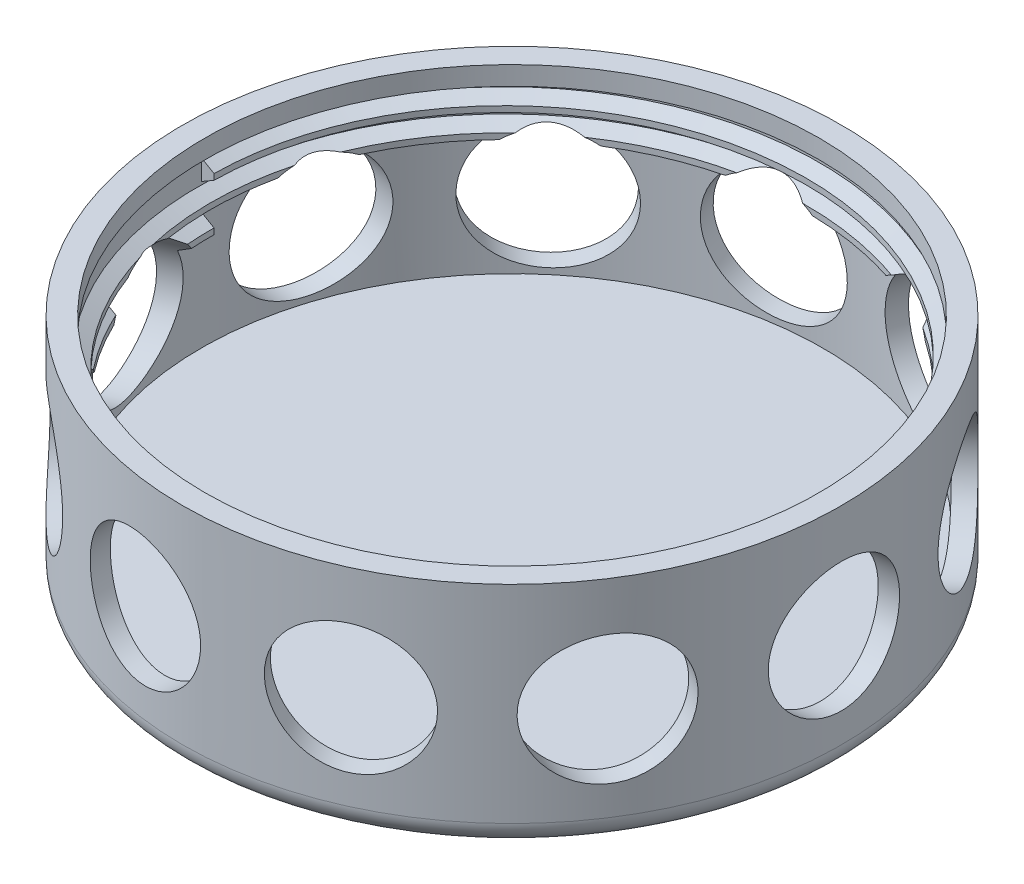
from build123d import *
from build123d.topology import SkipClean

# Parameters (mm, degrees)
SZKIC1_R                    = 14
DODANIE_WYCI_GNI_CIE2_DEPTH = 9
SZKIC5_R                    = 13.2
WYTNIJ_WYCI_GNI_CIE1_DEPTH  = 7
GWINT1_PITCH                = 1
SZKIC22_R                   = 14
SZKIC22_R_2                 = 13.05
DODANIE_WYCI_GNI_CIE3_DEPTH = 0.8
SZKIC23_R                   = 2.75
WYTNIJ_WYCI_GNI_CIE2_DEPTH  = 5
SZYK_KO_OWY1_COUNT          = 11
ZAOKR_GLENIE1_R             = 1


with BuildPart() as part:
    # Szkic1 → Dodanie-wyciągnięcie2 (new body)
    with BuildSketch(Plane(origin=(0, 0, 0), x_dir=(1, 0, 0), z_dir=(0, 1, 0))):
        with Locations(Location((0, 0, 0), (0, 0, 270))):
            Circle(SZKIC1_R)
    extrude(amount=DODANIE_WYCI_GNI_CIE2_DEPTH)

    # Szkic5 → Wytnij-wyciągnięcie1 (cut)
    with BuildSketch(Plane(origin=(0, 9, 0), x_dir=(1, 0, 0), z_dir=(0, 1, 0))):
        with Locations(Location((0, 0, 0), (0, 0, 270))):
            Circle(SZKIC5_R)
    extrude(amount=-WYTNIJ_WYCI_GNI_CIE1_DEPTH, mode=Mode.SUBTRACT)

    # Gwint1: the profile of Profil gwintu2 profile screwed along a right-hand helix of 2 turns, 8 arcs to a turn; built about Z, then put on its axis
    with SkipClean():  # the faces are left unmerged after this step: merging them gives an invalid solid
        gwint1_z = Axis((0, 0, 0), (0, 0, 1))
        gwint1_corners = [(13.2003, 0, -0.000173205), (13.2003, 0, 0.875173202), (12.658734125, 0, 0.562499999), (12.658734125, 0, 0.312499999)]
        with BuildLine(mode=Mode.PRIVATE) as gwint1_profile:
            Line(gwint1_corners[0], gwint1_corners[1])
            Line(gwint1_corners[1], gwint1_corners[2])
            Line(gwint1_corners[2], gwint1_corners[3])
            Line(gwint1_corners[3], gwint1_corners[0])
        gwint1_cap = Face(gwint1_profile.wire())
        gwint1_turn_angles = [0, 22.5, 45, 67.5, 90, 112.5, 135, 157.5, 180, 202.5, 225, 247.5, 270, 292.5, 315, 337.5, 360]
        gwint1_turn_weights = [1, 0.9238795325112867, 1, 0.9238795325112867, 1, 0.9238795325112867, 1, 0.9238795325112867, 1, 0.9238795325112867, 1, 0.9238795325112867, 1, 0.9238795325112867, 1, 0.9238795325112867, 1]
        gwint1_turn_rails = [Edge.make_bspline([Vector(p[0], p[1], 0).rotate(gwint1_z, gwint1_turn_angles[k]) / gwint1_turn_weights[k] + Vector(0, 0, p[2] + GWINT1_PITCH * gwint1_turn_angles[k] / 360) for k in range(17)], [0, 0, 0, 1, 1, 2, 2, 3, 3, 4, 4, 5, 5, 6, 6, 7, 7, 8, 8, 8], 2, gwint1_turn_weights) for p in gwint1_corners]
        gwint1_turn_sides = [Face.make_surface_from_curves(gwint1_turn_rails[p[0]], gwint1_turn_rails[p[1]]) for p in [(0, 1), (1, 2), (2, 3), (3, 0)]]
        gwint1 = Plane(origin=(0, 9, 0), x_dir=(-1, 0, 0), z_dir=(0, -1, 0)) * Solid(Shell([*[p.moved(Location((0, 0, GWINT1_PITCH * i))) for i in range(2) for p in gwint1_turn_sides], gwint1_cap, gwint1_cap.rotate(gwint1_z, 720).moved(Location((0, 0, GWINT1_PITCH * 720 / 360)))]))
        add(gwint1)

    # Szkic22 → Dodanie-wyciągnięcie3 (add)
    with SkipClean():  # the faces are left unmerged after this step: merging them gives an invalid solid
        with BuildSketch(Plane(origin=(0, 9, 0), x_dir=(1, 0, 0), z_dir=(0, 1, 0))):
            with Locations(Location((0, 0, 0), (0, 0, 270))):
                Circle(SZKIC22_R)
            with Locations(Location((0, 0, 0), (0, 0, 270))):
                Circle(SZKIC22_R_2, mode=Mode.SUBTRACT)
        extrude(amount=DODANIE_WYCI_GNI_CIE3_DEPTH)

    # Szkic23 → Wytnij-wyciągnięcie2 (cut)
    with BuildSketch(Plane.XY.offset(16)):
        with Locations((-2, 5)):
            Circle(SZKIC23_R)
    wytnij_wyci_gni_cie2 = extrude(amount=-WYTNIJ_WYCI_GNI_CIE2_DEPTH, mode=Mode.SUBTRACT)

    # Szyk kołowy1: Wytnij-wyciągnięcie2 ×11 about axis
    szyk_ko_owy1_axis = Axis((0, 0, 0), (0, -1, 0))
    for i in range(1, SZYK_KO_OWY1_COUNT):
        add(wytnij_wyci_gni_cie2.rotate(szyk_ko_owy1_axis, i * 360 / SZYK_KO_OWY1_COUNT), mode=Mode.SUBTRACT)

    # Zaokrąglenie1
    zaokr_glenie1_edges = [part.edges().sort_by_distance(p)[0] for p in [
        (0, 0, -14),
    ]]
    fillet(zaokr_glenie1_edges, radius=ZAOKR_GLENIE1_R)


solid = part.part
